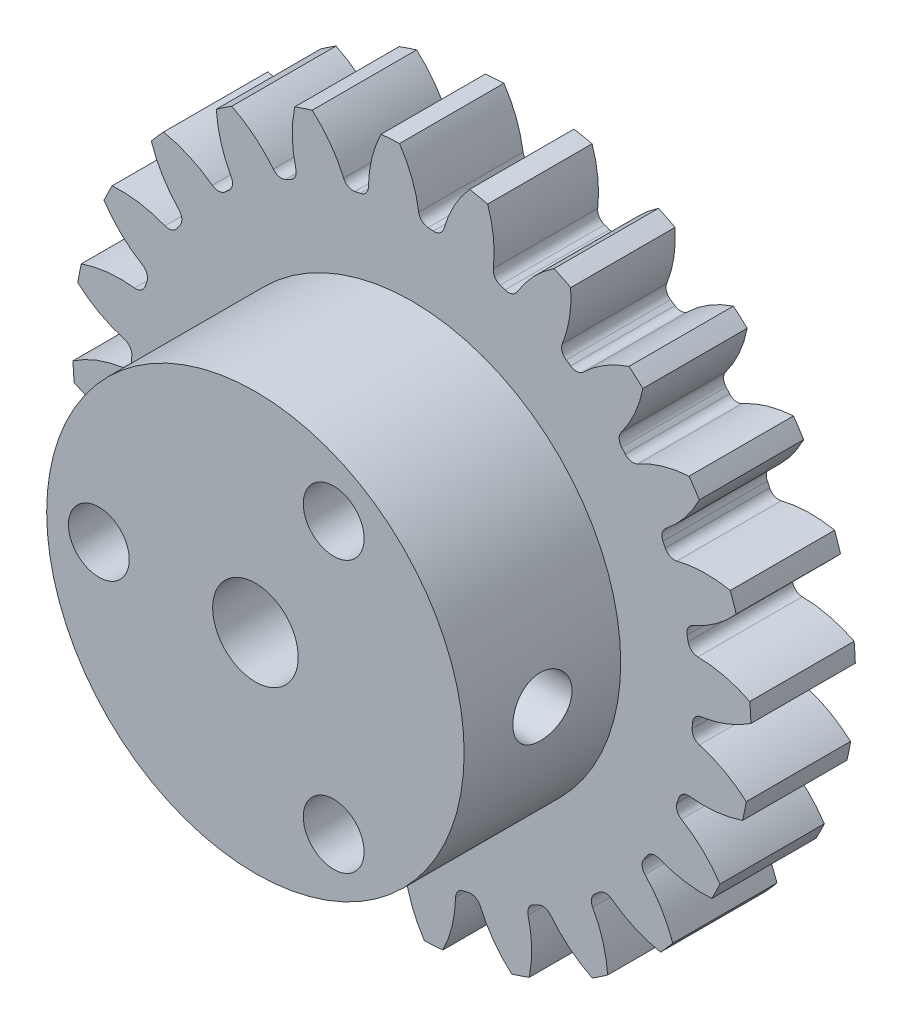
from build123d import *

# Parameters (mm, degrees)
SKETCH3_R           = 20.6375
GEARBODY_DEPTH      = 6.35
TOOTHCUT_DEPTH      = 30.868634259
CIRPATTERN1_COUNT   = 24
HUB2DIA_R           = 12.7
BOSS_EXTRUDE1_DEPTH = 9.525
SKETCH4_R           = 1.849999983
CUT_EXTRUDE1_DEPTH  = 34.206692975
SKETCH5_R           = 2.6035
CUT_EXTRUDE2_DEPTH  = 34.206692975
SKETCH6_R           = 1.799999956
CUT_EXTRUDE3_DEPTH  = 34.206692975


with BuildPart() as part:
    # Sketch3 → gearBody (new body)
    with BuildSketch(Plane.XY):
        Circle(SKETCH3_R)
    extrude(amount=GEARBODY_DEPTH)

    # Sketch2 → toothCut (cut, through all)
    with BuildSketch(Plane.XY):
        with BuildLine():
            ThreePointArc((17.04439181, -1.303986765), (17.05590718, -1.14354882), (17.065912391, -0.983009622))
            ThreePointArc((17.065912391, -0.983009622), (17.226475942, -0.603092534), (17.591114308, -0.410332293))
            ThreePointArc((17.591114308, -0.410332293), (20.42378314, 0.626979823), (22.599606758, 2.716434472))
            ThreePointArc((22.599606758, 2.716434472), (22.711286815, -1.522725526), (22.034703624, -5.709034773))
            ThreePointArc((22.034703624, -5.709034773), (20.157284273, -3.347822008), (17.488443939, -1.941649751))
            ThreePointArc((17.488443939, -1.941649751), (17.152801577, -1.701937731), (17.04439181, -1.303986765))
        make_face()
    toothcut = extrude(amount=TOOTHCUT_DEPTH, mode=Mode.SUBTRACT)

    # CirPattern1: toothCut ×24 about axis
    cirpattern1_axis = Axis((0, 0, 6.35), (0, 0, -1))
    for i in range(1, CIRPATTERN1_COUNT):
        add(toothcut.rotate(cirpattern1_axis, i * 360 / CIRPATTERN1_COUNT), mode=Mode.SUBTRACT)

    # hub2Dia → Boss-Extrude1 (add)
    with BuildSketch(Plane.XY.offset(6.35)):
        Circle(HUB2DIA_R)
    extrude(amount=BOSS_EXTRUDE1_DEPTH)

    # Sketch4 → Cut-Extrude1 (cut, through all)
    with BuildSketch(Plane(origin=(0, 0, 0), x_dir=(-1, 0, 0), z_dir=(0, 0, -1))):
        with Locations((9.525, 0)):
            Circle(SKETCH4_R)
        with Locations((-4.7625, -8.248891971)):
            Circle(SKETCH4_R)
        with Locations((-4.7625, 8.248891971)):
            Circle(SKETCH4_R)
    extrude(amount=-CUT_EXTRUDE1_DEPTH, mode=Mode.SUBTRACT)

    # Sketch5 → Cut-Extrude2 (cut, through all)
    with BuildSketch(Plane(origin=(0, 0, 0), x_dir=(-1, 0, 0), z_dir=(0, 0, -1))):
        Circle(SKETCH5_R)
    extrude(amount=-CUT_EXTRUDE2_DEPTH, mode=Mode.SUBTRACT)

    # Sketch6 → Cut-Extrude3 (cut, through all)
    with BuildSketch(Plane(origin=(0, 0, 0), x_dir=(0, 0, -1), z_dir=(1, 0, 0))):
        with Locations((-11.1125, 0)):
            Circle(SKETCH6_R)
    extrude(amount=CUT_EXTRUDE3_DEPTH, mode=Mode.SUBTRACT)


solid = part.part
